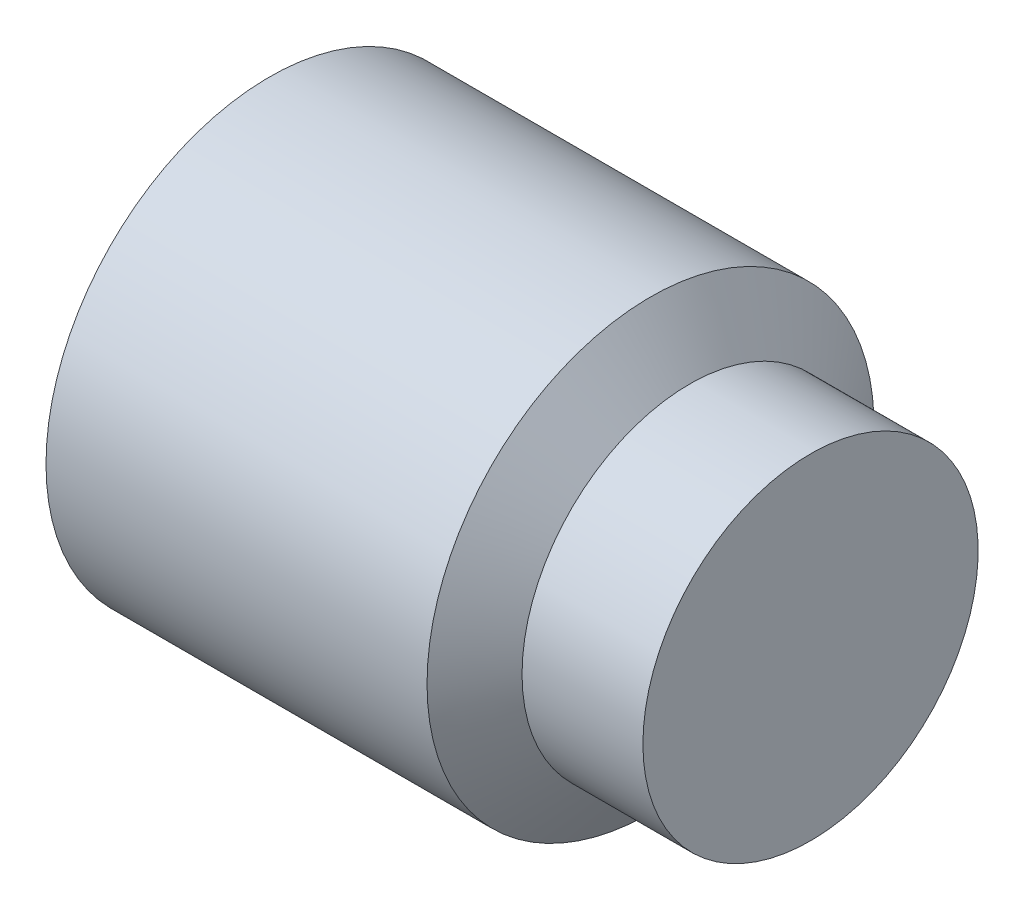
from build123d import *

# Parameters (mm, degrees)
HEX_2_DEPTH = 12


with BuildPart() as part:
    # BodySke → BaseBody (revolve)
    with BuildSketch(Plane.XY):
        Polygon((0, 0), (0, 10.352), (0.951473244, 12), (21.409377385, 12), (23.51, 9), (30, 9), (30, 0), align=None)
    revolve(axis=Axis((-12.7, 0, 0), (1, 0, 0)))

    # Sketch2 → Hex 2 (cut)
    with BuildSketch(Plane.ZY):
        Polygon((3.464101615, 6), (-3.464101615, 6), (-6.92820323, 0), (-3.464101615, -6), (3.464101615, -6), (6.92820323, 0), align=None)
    extrude(amount=-HEX_2_DEPTH, mode=Mode.SUBTRACT)


solid = part.part
